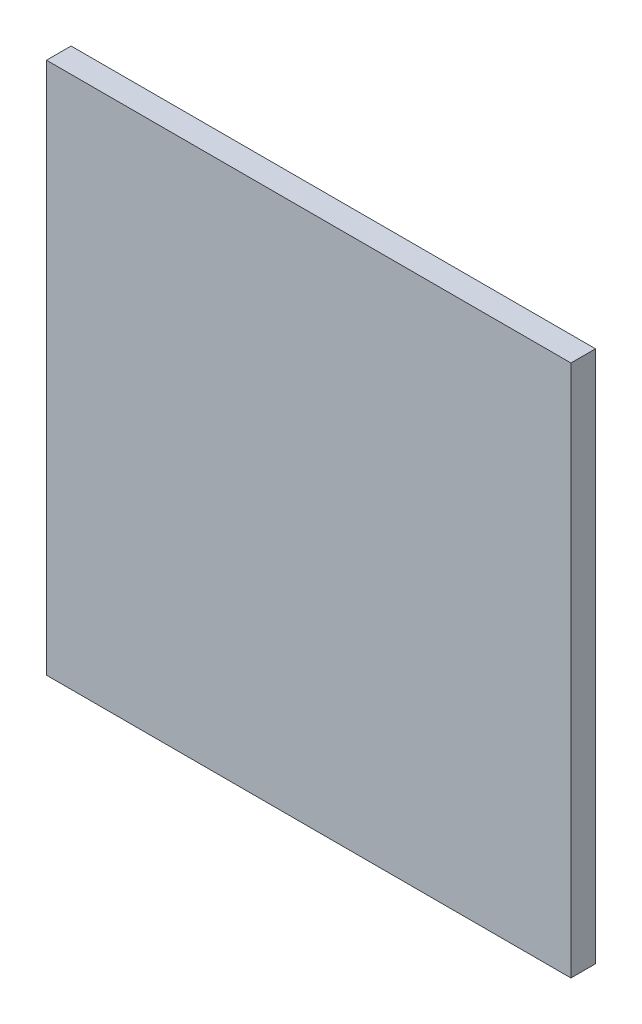
from build123d import *

# Parameters (mm, degrees)
SKETCH1_W           = 64
SKETCH1_H           = 65
BOSS_EXTRUDE1_DEPTH = 3


with BuildPart() as part:
    # Sketch1 → Boss-Extrude1 (new body)
    with BuildSketch(Plane.XY):
        Rectangle(SKETCH1_W, SKETCH1_H)
    extrude(amount=BOSS_EXTRUDE1_DEPTH)


solid = part.part
